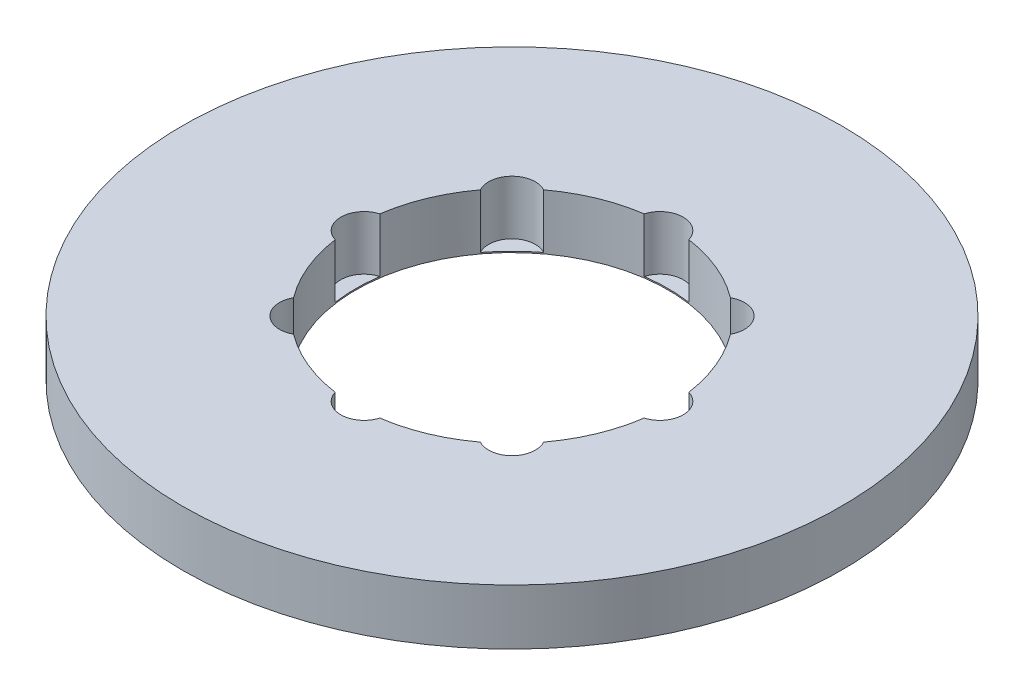
from build123d import *

# Parameters (mm, degrees)
SKETCH1_R           = 95
BOSS_EXTRUDE1_DEPTH = 16
SKETCH2_R           = 45
CUT_EXTRUDE1_DEPTH  = 136.299667405
SKETCH3_R           = 6.71547706
CUT_EXTRUDE2_DEPTH  = 15.632938098
CIRPATTERN1_COUNT   = 8


with BuildPart() as part:
    # Sketch1 → Boss-Extrude1 (new body)
    with BuildSketch(Plane(origin=(0, 0, 0), x_dir=(1, 0, 0), z_dir=(0, 1, 0))):
        Circle(SKETCH1_R)
    extrude(amount=BOSS_EXTRUDE1_DEPTH)

    # Sketch2 → Cut-Extrude1 (cut, through all)
    with BuildSketch(Plane(origin=(0, 0, 0), x_dir=(1, 0, 0), z_dir=(0, 1, 0))):
        Circle(SKETCH2_R)
    extrude(amount=CUT_EXTRUDE1_DEPTH, mode=Mode.SUBTRACT)

    # Sketch3 → Cut-Extrude2 (cut)
    with BuildSketch(Plane(origin=(0, 16, 0), x_dir=(1, 0, 0), z_dir=(0, 1, 0))):
        with Locations((-42.638124393, 0)):
            Circle(SKETCH3_R)
    cut_extrude2 = extrude(amount=-CUT_EXTRUDE2_DEPTH, mode=Mode.SUBTRACT)

    # CirPattern1: Cut-Extrude2 ×8 about axis
    cirpattern1_axis = Axis((0, 0, 0), (0, 1, 0))
    for i in range(1, CIRPATTERN1_COUNT):
        add(cut_extrude2.rotate(cirpattern1_axis, i * 360 / CIRPATTERN1_COUNT), mode=Mode.SUBTRACT)


solid = part.part
